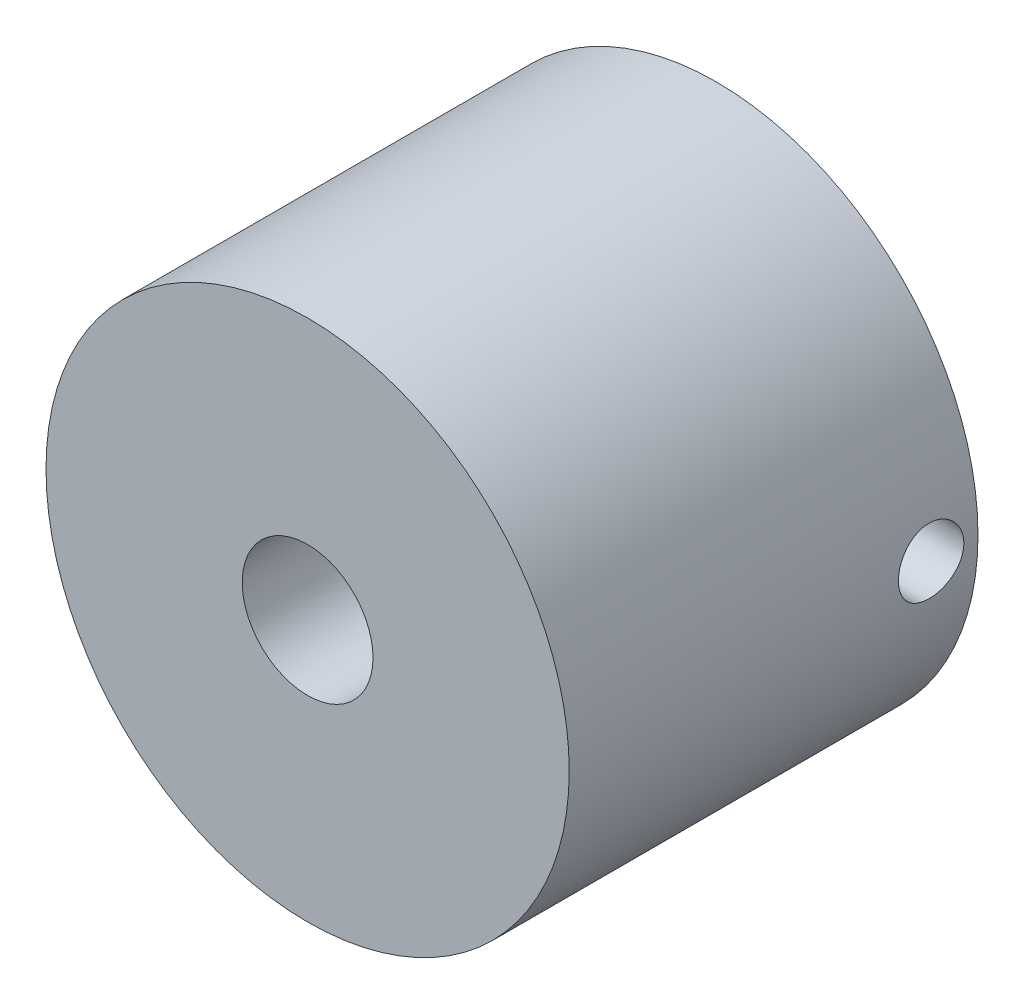
from build123d import *

# Parameters (mm, degrees)
SKETCH1_R               = 16
SKETCH1_R_2             = 6
BOSS_EXTRUDE1_DEPTH     = 14
BOSS_EXTRUDE2_START     = -8
SKETCH2_R               = 6
SKETCH2_R_2             = 3
BOSS_EXTRUDE2_DEPTH     = 8
THREAD1_PITCH           = 1
CUT_EXTRUDE1_DEPTH      = 27.608360697
CUT_EXTRUDE1_DEPTH_BACK = 27.608360697
SKETCH14_R              = 2
SKETCH21_R              = 16
SKETCH21_R_2            = 4
BOSS_EXTRUDE3_DEPTH     = 11


with BuildPart() as part:
    # Sketch1 → Boss-Extrude1 (new body)
    with BuildSketch(Plane.XY):
        Circle(SKETCH1_R)
        Circle(SKETCH1_R_2, mode=Mode.SUBTRACT)
    extrude(amount=BOSS_EXTRUDE1_DEPTH)

    # Sketch2 → Boss-Extrude2 (add)
    with BuildSketch(Plane.XY.offset(14).offset(BOSS_EXTRUDE2_START)):
        Circle(SKETCH2_R)
        Circle(SKETCH2_R_2, mode=Mode.SUBTRACT)
    extrude(amount=BOSS_EXTRUDE2_DEPTH)

    # Thread1: the profile of Thread Profile2 profile screwed along a right-hand helix of 8 turns, 8 arcs to a turn; built about Z, then put on its axis
    thread1_z = Axis((0, 0, 0), (0, 0, 1))
    thread1_corners = [(3.0003, 0, -0.000173205), (3.0003, 0, 0.277985704), (2.828148085, 0, 0.17859375), (2.828148085, 0, 0.09921875)]
    with BuildLine(mode=Mode.PRIVATE) as thread1_profile:
        Line(thread1_corners[0], thread1_corners[1])
        Line(thread1_corners[1], thread1_corners[2])
        Line(thread1_corners[2], thread1_corners[3])
        Line(thread1_corners[3], thread1_corners[0])
    thread1_cap = Face(thread1_profile.wire())
    thread1_turn_angles = [0, 22.5, 45, 67.5, 90, 112.5, 135, 157.5, 180, 202.5, 225, 247.5, 270, 292.5, 315, 337.5, 360]
    thread1_turn_weights = [1, 0.9238795325112867, 1, 0.9238795325112867, 1, 0.9238795325112867, 1, 0.9238795325112867, 1, 0.9238795325112867, 1, 0.9238795325112867, 1, 0.9238795325112867, 1, 0.9238795325112867, 1]
    thread1_turn_rails = [Edge.make_bspline([Vector(p[0], p[1], 0).rotate(thread1_z, thread1_turn_angles[k]) / thread1_turn_weights[k] + Vector(0, 0, p[2] + THREAD1_PITCH * thread1_turn_angles[k] / 360) for k in range(17)], [0, 0, 0, 1, 1, 2, 2, 3, 3, 4, 4, 5, 5, 6, 6, 7, 7, 8, 8, 8], 2, thread1_turn_weights) for p in thread1_corners]
    thread1_turn_sides = [Face.make_surface_from_curves(thread1_turn_rails[p[0]], thread1_turn_rails[p[1]]) for p in [(0, 1), (1, 2), (2, 3), (3, 0)]]
    thread1 = Plane(origin=(0, 0, 14), x_dir=(-1, 0, 0), z_dir=(0, 0, -1)) * Solid(Shell([*[p.moved(Location((0, 0, THREAD1_PITCH * i))) for i in range(8) for p in thread1_turn_sides], thread1_cap, thread1_cap.rotate(thread1_z, 2880).moved(Location((0, 0, THREAD1_PITCH * 2880 / 360)))]))
    add(thread1)

    # Sketch14 → Cut-Extrude1 (cut, two sides: drawn at the far end of the back side and taken through both)
    with BuildSketch(Plane(origin=(0, 0, 0), x_dir=(0, 0, -1), z_dir=(1, 0, 0)).offset(-CUT_EXTRUDE1_DEPTH_BACK)):
        with Locations(Location((-2.866213664, 0, 0), (0, 0, 180))):
            Circle(SKETCH14_R)
    extrude(amount=CUT_EXTRUDE1_DEPTH + CUT_EXTRUDE1_DEPTH_BACK, mode=Mode.SUBTRACT)

    # Sketch21 → Boss-Extrude3 (add)
    with BuildSketch(Plane.XY.offset(14)):
        Circle(SKETCH21_R)
        Circle(SKETCH21_R_2, mode=Mode.SUBTRACT)
    extrude(amount=BOSS_EXTRUDE3_DEPTH)


solid = part.part
